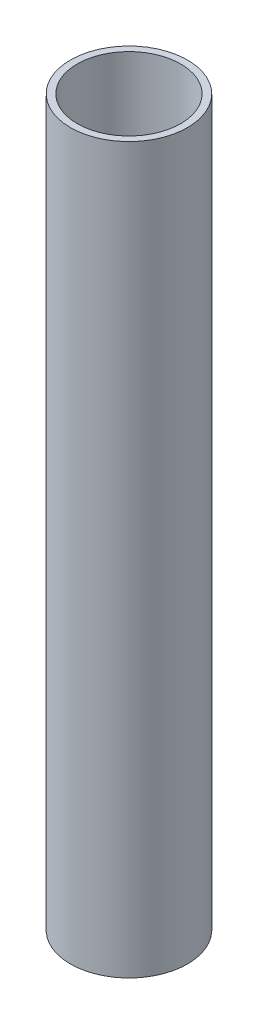
from build123d import *

# Parameters (mm, degrees)
SKETCH2_R   = 43
SKETCH2_R_2 = 38
BODY_DEPTH  = 532


with BuildPart() as part:
    # Sketch2 → body (new body)
    with BuildSketch(Plane(origin=(0, 0, 0), x_dir=(1, 0, 0), z_dir=(0, 1, 0))):
        Circle(SKETCH2_R)
        Circle(SKETCH2_R_2, mode=Mode.SUBTRACT)
    extrude(amount=BODY_DEPTH)


solid = part.part
